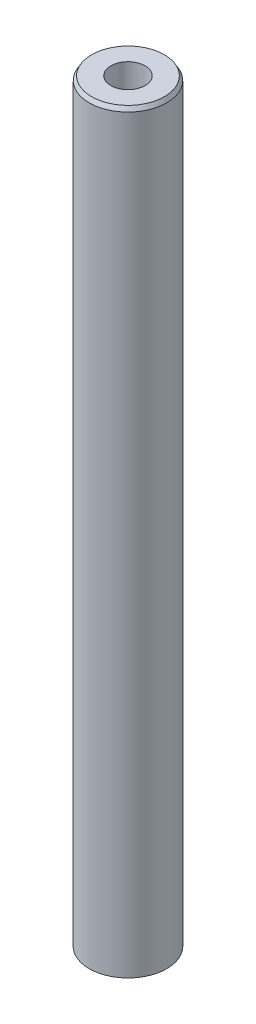
from build123d import *
from OCP.BRepFilletAPI import BRepFilletAPI_MakeChamfer

# Parameters (mm, degrees)
SKETCH1_R           = 30
BOSS_EXTRUDE1_DEPTH = 585.730108052
SKETCH2_R           = 13.289874272
CUT_EXTRUDE1_DEPTH  = 588.264641774
CHAMFER1_SIZE       = 3.202547421
CHAMFER1_SIZE2      = 1.848991615


with BuildPart() as part:
    # Sketch1 → Boss-Extrude1 (new body)
    with BuildSketch(Plane(origin=(0, 0, 0), x_dir=(1, 0, 0), z_dir=(0, 1, 0))):
        Circle(SKETCH1_R)
    extrude(amount=BOSS_EXTRUDE1_DEPTH)

    # Sketch2 → Cut-Extrude1 (cut, through all)
    with BuildSketch(Plane(origin=(0, 0, 0), x_dir=(1, 0, 0), z_dir=(0, 1, 0))):
        Circle(SKETCH2_R)
    extrude(amount=CUT_EXTRUDE1_DEPTH, mode=Mode.SUBTRACT)

    # Chamfer1: one chamfer whose edges measure the first distance from different faces: ONE call of the kernel's chamfer builder (chamfer() names one face for all edges)
    chamfer1_edges_1 = [part.edges().sort_by_distance(p)[0] for p in [
        (-30, 585.730108052, 0),
    ]]
    chamfer1_side_1 = [part.faces().sort_by_distance(p)[0] for p in [
        (-30, 292.865054026, 0),
    ]]
    chamfer1_edges_2 = [part.edges().sort_by_distance(p)[0] for p in [
        (-30, 0, 0),
    ]]
    chamfer1_side_2 = [part.faces().sort_by_distance(p)[0] for p in [
        (-29.151471863, 0, 0),
    ]]
    chamfer1 = BRepFilletAPI_MakeChamfer(part.part.solid().wrapped)
    for e in chamfer1_edges_1:
        chamfer1.Add(CHAMFER1_SIZE, CHAMFER1_SIZE2, e.wrapped, chamfer1_side_1[0].wrapped)  # the first distance lies on this face
    for e in chamfer1_edges_2:
        chamfer1.Add(CHAMFER1_SIZE, CHAMFER1_SIZE2, e.wrapped, chamfer1_side_2[0].wrapped)  # the first distance lies on this face
    add(Compound.cast(chamfer1.Shape()), mode=Mode.REPLACE)


solid = part.part
